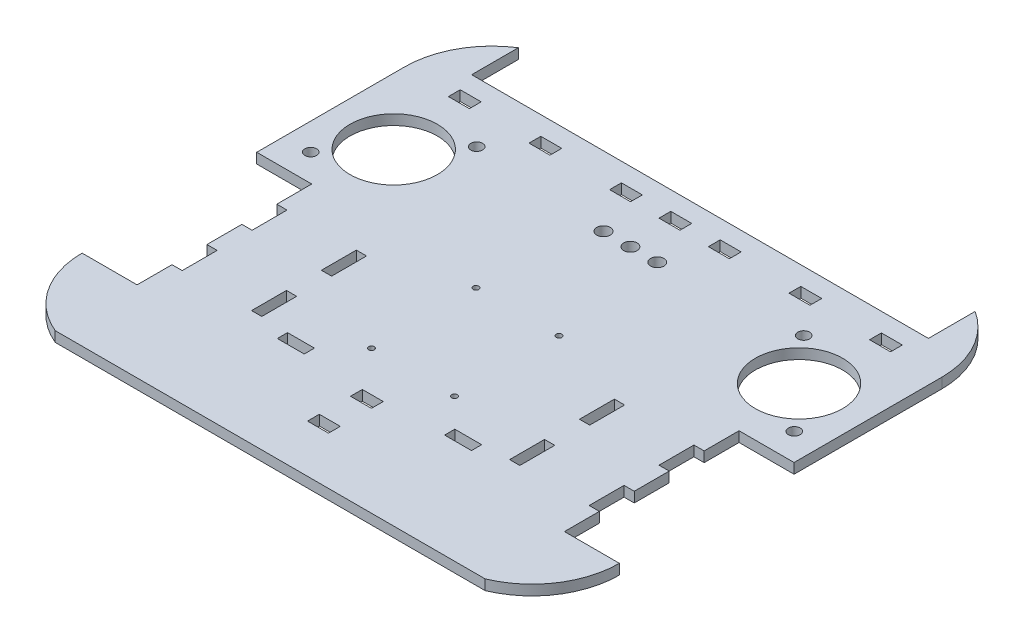
from build123d import *

# Parameters (mm, degrees)
SKETCH1_W           = 254
SKETCH1_H           = 228.6
BOSS_EXTRUDE1_DEPTH = 4.826
SKETCH2_W           = 26.00000007
SKETCH2_H           = 82.55
CUT_EXTRUDE1_DEPTH  = 4.826
CUT_EXTRUDE3_DEPTH  = 4.826
SKETCH7_W           = 215.9
SKETCH7_H           = 25.4
CUT_EXTRUDE5_DEPTH  = 4.826
CUT_EXTRUDE6_DEPTH  = 4.826
SKETCH10_W          = 4.826
SKETCH10_H          = 16.51
CUT_EXTRUDE8_DEPTH  = 171.929167423
SKETCH12_W          = 4.826
SKETCH12_H          = 16.51
CUT_EXTRUDE9_DEPTH  = 171.929167423
SKETCH13_W          = 4.826
SKETCH13_H          = 16.51
CUT_EXTRUDE10_DEPTH = 171.929167423
SKETCH15_R          = 1.3462
CUT_EXTRUDE11_DEPTH = 171.929167423
SKETCH16_R          = 2.778125
SKETCH16_R_2        = 20.6375
CUT_EXTRUDE12_DEPTH = 171.929167423
SKETCH17_W          = 9.906
SKETCH17_H          = 5.588
CUT_EXTRUDE13_DEPTH = 171.929167423
SKETCH18_W          = 9.906
SKETCH18_H          = 5.588
CUT_EXTRUDE14_DEPTH = 171.929167423
SKETCH19_R          = 3.175
CUT_EXTRUDE15_DEPTH = 171.929167423
SKETCH22_W          = 12.7
SKETCH22_H          = 4.826
CUT_EXTRUDE18_DEPTH = 171.929167423


with BuildPart() as part:
    # Sketch1 → Boss-Extrude1 (new body)
    with BuildSketch(Plane(origin=(0, 0, 0), x_dir=(1, 0, 0), z_dir=(0, 1, 0))):
        Rectangle(SKETCH1_W, SKETCH1_H)
    extrude(amount=BOSS_EXTRUDE1_DEPTH)

    # Sketch2 → Cut-Extrude1 (cut)
    with BuildSketch(Plane(origin=(0, 4.826, 0), x_dir=(1, 0, 0), z_dir=(0, 1, 0))):
        with Locations((-113.999999965, -34.925)):
            Rectangle(SKETCH2_W, SKETCH2_H)
        with Locations((113.999999965, -34.925)):
            Rectangle(SKETCH2_W, SKETCH2_H)
    extrude(amount=-CUT_EXTRUDE1_DEPTH, mode=Mode.SUBTRACT)

    # Sketch4 → Cut-Extrude3 (cut)
    with BuildSketch(Plane(origin=(0, 4.826, 0), x_dir=(1, 0, 0), z_dir=(0, 1, 0))):
        with BuildLine():
            Line((-127, 76.2), (-127, 114.3))
            Line((-127, 114.3), (-101.6, 114.3))
            ThreePointArc((-101.6, 114.3), (-120.067875899, 99.095250599), (-127, 76.2))
        make_face()
        with BuildLine():
            Line((127, 76.2), (127, 114.3))
            Line((127, 114.3), (101.6, 114.3))
            ThreePointArc((101.6, 114.3), (120.067875899, 99.095250599), (127, 76.2))
        make_face()
    extrude(amount=-CUT_EXTRUDE3_DEPTH, mode=Mode.SUBTRACT)

    # Sketch7 → Cut-Extrude5 (cut)
    with BuildSketch(Plane(origin=(0, 4.826, 0), x_dir=(1, 0, 0), z_dir=(0, 1, 0))):
        with Locations((0, 101.6)):
            Rectangle(SKETCH7_W, SKETCH7_H)
    extrude(amount=-CUT_EXTRUDE5_DEPTH, mode=Mode.SUBTRACT)

    # Sketch8 → Cut-Extrude6 (cut)
    with BuildSketch(Plane(origin=(0, 4.826, 0), x_dir=(1, 0, 0), z_dir=(0, 1, 0))):
        with BuildLine():
            Line((-127, -76.2), (-127, -114.3))
            Line((-127, -114.3), (-101.6, -114.3))
            ThreePointArc((-101.6, -114.3), (-120.067875899, -99.095250599), (-127, -76.2))
        make_face()
        with BuildLine():
            Line((127, -114.3), (101.6, -114.3))
            ThreePointArc((101.6, -114.3), (120.067875899, -99.095250599), (127, -76.2))
            Line((127, -76.2), (127, -114.3))
        make_face()
    extrude(amount=-CUT_EXTRUDE6_DEPTH, mode=Mode.SUBTRACT)

    # Sketch10 → Cut-Extrude8 (cut, through all)
    with BuildSketch(Plane(origin=(0, 4.826, 0), x_dir=(1, 0, 0), z_dir=(0, 1, 0))):
        with Locations((-98.58699993, -51.435)):
            Rectangle(SKETCH10_W, SKETCH10_H)
        with Locations((-98.58699993, -18.415)):
            Rectangle(SKETCH10_W, SKETCH10_H)
        with Locations((98.58699993, -18.415)):
            Rectangle(SKETCH10_W, SKETCH10_H)
        with Locations((98.58699993, -51.435)):
            Rectangle(SKETCH10_W, SKETCH10_H)
    extrude(amount=-CUT_EXTRUDE8_DEPTH, mode=Mode.SUBTRACT)

    # Sketch12 → Cut-Extrude9 (cut, through all)
    with BuildSketch(Plane.XZ):
        with Locations((-60.99499993, 51.435)):
            Rectangle(SKETCH12_W, SKETCH12_H)
        with Locations((-60.99499993, 18.415)):
            Rectangle(SKETCH12_W, SKETCH12_H)
    extrude(amount=-CUT_EXTRUDE9_DEPTH, mode=Mode.SUBTRACT)

    # Sketch13 → Cut-Extrude10 (cut, through all)
    with BuildSketch(Plane(origin=(0, 4.826, 0), x_dir=(1, 0, 0), z_dir=(0, 1, 0))):
        with Locations((60.99499993, -51.435)):
            Rectangle(SKETCH13_W, SKETCH13_H)
        with Locations((60.99499993, -18.415)):
            Rectangle(SKETCH13_W, SKETCH13_H)
    extrude(amount=-CUT_EXTRUDE10_DEPTH, mode=Mode.SUBTRACT)

    # Sketch15 → Cut-Extrude11 (cut, through all)
    with BuildSketch(Plane(origin=(0, 4.826, 0), x_dir=(1, 0, 0), z_dir=(0, 1, 0))):
        with Locations((19.5961, 2.669161094)):
            Circle(SKETCH15_R)
        with Locations((-19.6723, 2.669161094)):
            Circle(SKETCH15_R)
        with Locations((-19.6723, -46.763561094)):
            Circle(SKETCH15_R)
        with Locations((19.5961, -46.763561094)):
            Circle(SKETCH15_R)
    extrude(amount=-CUT_EXTRUDE11_DEPTH, mode=Mode.SUBTRACT)

    # Sketch16 → Cut-Extrude12 (cut, through all)
    with BuildSketch(Plane(origin=(0, 4.826, 0), x_dir=(1, 0, 0), z_dir=(0, 1, 0))):
        with Locations((77.293854564, 60.610218612)):
            Circle(SKETCH16_R)
        with Locations((114.3, 19.164632523)):
            Circle(SKETCH16_R)
        with Locations((95.796927282, 39.887425568)):
            Circle(SKETCH16_R_2)
        with Locations((-95.796927282, 39.887425568)):
            Circle(SKETCH16_R_2)
        with Locations((-77.293854564, 60.610218612)):
            Circle(SKETCH16_R)
        with Locations((-114.3, 19.164632523)):
            Circle(SKETCH16_R)
    extrude(amount=-CUT_EXTRUDE12_DEPTH, mode=Mode.SUBTRACT)

    # Sketch17 → Cut-Extrude13 (cut, through all)
    with BuildSketch(Plane(origin=(0, 4.826, 0), x_dir=(1, 0, 0), z_dir=(0, 1, 0))):
        with Locations((-61.445869789, 77.244822677)):
            Rectangle(SKETCH17_W, SKETCH17_H)
        with Locations((-99.545869789, 77.244822677)):
            Rectangle(SKETCH17_W, SKETCH17_H)
        with Locations((-23.345869789, 77.244822677)):
            Rectangle(SKETCH17_W, SKETCH17_H)
        with Locations((0, 77.244822677)):
            Rectangle(SKETCH17_W, SKETCH17_H)
        with Locations((23.345869789, 77.244822677)):
            Rectangle(SKETCH17_W, SKETCH17_H)
        with Locations((61.445869789, 77.244822677)):
            Rectangle(SKETCH17_W, SKETCH17_H)
        with Locations((99.545869789, 77.244822677)):
            Rectangle(SKETCH17_W, SKETCH17_H)
    extrude(amount=-CUT_EXTRUDE13_DEPTH, mode=Mode.SUBTRACT)

    # Sketch18 → Cut-Extrude14 (cut, through all)
    with BuildSketch(Plane(origin=(0, 4.826, 0), x_dir=(1, 0, 0), z_dir=(0, 1, 0))):
        with Locations((0, -88.9)):
            Rectangle(SKETCH18_W, SKETCH18_H)
        with Locations((0, -68.58)):
            Rectangle(SKETCH18_W, SKETCH18_H)
    extrude(amount=-CUT_EXTRUDE14_DEPTH, mode=Mode.SUBTRACT)

    # Sketch19 → Cut-Extrude15 (cut, through all)
    with BuildSketch(Plane(origin=(0, 4.826, 0), x_dir=(1, 0, 0), z_dir=(0, 1, 0))):
        with Locations((0, 55.982011538)):
            Circle(SKETCH19_R)
        with Locations((12.7, 55.982011538)):
            Circle(SKETCH19_R)
        with Locations((-12.7, 55.982011538)):
            Circle(SKETCH19_R)
    extrude(amount=-CUT_EXTRUDE15_DEPTH, mode=Mode.SUBTRACT)

    # Sketch22 → Cut-Extrude18 (cut, through all)
    with BuildSketch(Plane.XZ):
        with Locations((-39.53199993, 62.611)):
            Rectangle(SKETCH22_W, SKETCH22_H)
        with Locations((39.53199993, 62.611)):
            Rectangle(SKETCH22_W, SKETCH22_H)
    extrude(amount=-CUT_EXTRUDE18_DEPTH, mode=Mode.SUBTRACT)


solid = part.part
